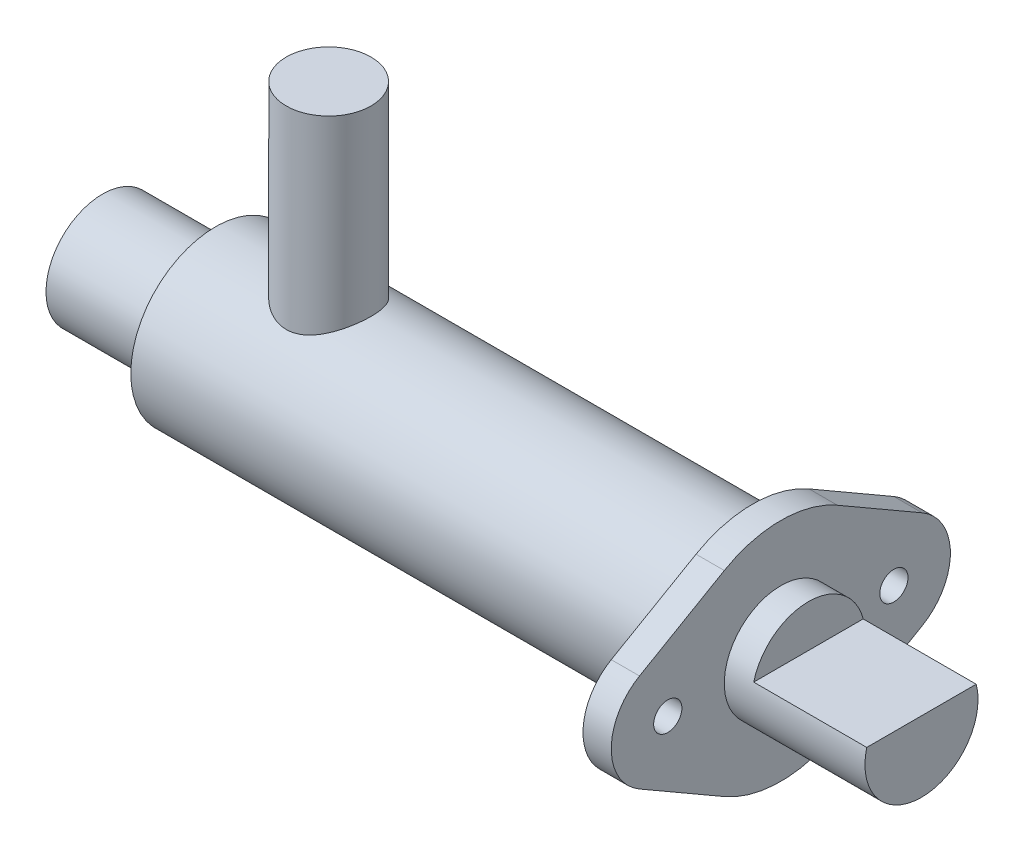
from build123d import *

# Parameters (mm, degrees)
SKETCH7_R           = 1.5875
BOSS_EXTRUDE2_DEPTH = 3.175
SKETCH5_R           = 6.35
CUT_EXTRUDE1_DEPTH  = 41.348883888
EXTRUDE1_START      = 57.15
SKETCH8_R           = 6.35
EXTRUDE1_DEPTH      = 57.15
CUT_EXTRUDE2_DEPTH  = 12.7
SKETCH10_R          = 4.7625
EXTRUDE2_DEPTH      = 30


with BuildPart() as part:
    # Sketch4 → Boss-Revolve2 (revolve)
    with BuildSketch(Plane.XY):
        Polygon((-47.625, 0), (-47.625, -6.35), (-34.925, -6.35), (-34.925, -9.525), (28.575, -9.525), (28.575, 0), align=None)
    revolve(axis=Axis((-47.625, 0, 0), (1, 0, 0)))

    # Sketch7 → Boss-Extrude2 (add)
    with BuildSketch(Plane(origin=(28.575, 29.318732004, 10.174246846), x_dir=(0, 0.7071067811865488, -0.7071067811865462), z_dir=(1, 0, 0))):
        with BuildLine():
            Line((-20.873950462, -12.811868036), (-10.250193405, -15.65849516))
            ThreePointArc((-10.250193405, -15.65849516), (-4.556939156, -18.945497033), (-1.269937284, -24.638751281))
            Line((-1.269937284, -24.638751281), (1.57668984, -35.262508339))
            ThreePointArc((1.57668984, -35.262508339), (-0.066811096, -41.396137336), (-6.200440093, -43.039638272))
            Line((-6.200440093, -43.039638272), (-16.82419715, -40.193011148))
            ThreePointArc((-16.82419715, -40.193011148), (-22.517451399, -36.906009275), (-25.804453271, -31.212755027))
            Line((-25.804453271, -31.212755027), (-28.651080396, -20.588997969))
            ThreePointArc((-28.651080396, -20.588997969), (-27.007579459, -14.455368972), (-20.873950462, -12.811868036))
        make_face()
        with Locations((-22.517451399, -18.945497033)):
            Circle(SKETCH7_R, mode=Mode.SUBTRACT)
        with Locations((-4.556939156, -36.906009275)):
            Circle(SKETCH7_R, mode=Mode.SUBTRACT)
    extrude(amount=-BOSS_EXTRUDE2_DEPTH)

    # Sketch5 → Cut-Extrude1 (cut)
    with BuildSketch(Plane(origin=(28.575, 0, 0), x_dir=(0, 0, -1), z_dir=(1, 0, 0))):
        Circle(SKETCH5_R)
    extrude(amount=-CUT_EXTRUDE1_DEPTH, mode=Mode.SUBTRACT)

    # Sketch8 → Extrude1 (add)
    with BuildSketch(Plane(origin=(-12.773883888, 0, 0), x_dir=(0, 0, -1), z_dir=(1, 0, 0)).offset(EXTRUDE1_START)):
        Circle(SKETCH8_R)
    extrude(amount=-EXTRUDE1_DEPTH)

    # Sketch9 → Cut-Extrude2 (cut)
    with BuildSketch(Plane(origin=(44.376116112, 0, 0), x_dir=(0, 0, -1), z_dir=(1, 0, 0))):
        with BuildLine():
            Line((-6.148361062, 1.5875), (6.148361062, 1.5875))
            ThreePointArc((6.148361062, 1.5875), (0, 6.35), (-6.148361062, 1.5875))
        make_face()
    extrude(amount=-CUT_EXTRUDE2_DEPTH, mode=Mode.SUBTRACT)

    # Sketch10 → Extrude2 (add)
    with BuildSketch(Plane(origin=(0, 0, 0), x_dir=(1, 0, 0), z_dir=(0, 1, 0))):
        with Locations((-22.225, 0)):
            Circle(SKETCH10_R)
    extrude(amount=EXTRUDE2_DEPTH)


solid = part.part
